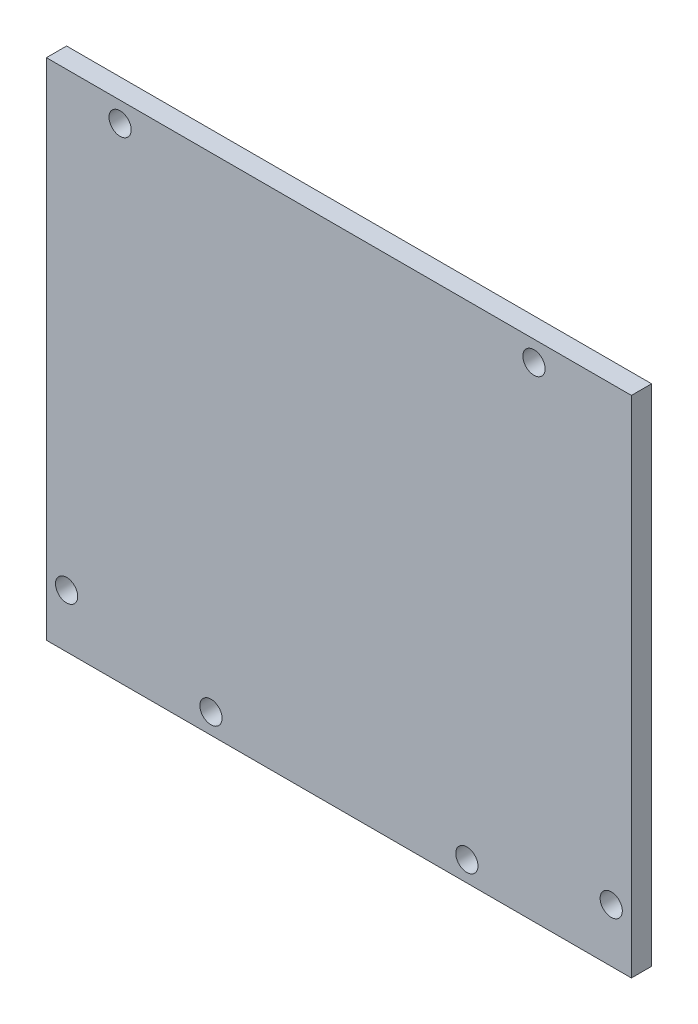
from build123d import *

# Parameters (mm, degrees)
MAIN_STOCK_START           = 11.1
SKETCH_1_W                 = 57.95
SKETCH_1_H                 = 49.98
MAIN_STOCK_DEPTH           = 2
SKETCH_2_R                 = 1.1
COVER_6XD2P2_THROUGH_DEPTH = 71.491027089


with BuildPart() as part:
    # 草图1 → Main_Stock (new body)
    with BuildSketch(Plane.XY.offset(MAIN_STOCK_START)):
        with Locations((24.675, 20.69)):
            Rectangle(SKETCH_1_W, SKETCH_1_H)
    extrude(amount=MAIN_STOCK_DEPTH)

    # 草图2 → Cover_6xD2p2_Through (cut, through all)
    with BuildSketch(Plane.XY.offset(13.1)):
        with Locations((-2.3, 1)):
            Circle(SKETCH_2_R)
        with Locations((51.65, 1)):
            Circle(SKETCH_2_R)
        with Locations((12, -2.3)):
            Circle(SKETCH_2_R)
        with Locations((37.35, -2.3)):
            Circle(SKETCH_2_R)
        with Locations((3, 43.68)):
            Circle(SKETCH_2_R)
        with Locations((44, 43.68)):
            Circle(SKETCH_2_R)
    extrude(amount=-COVER_6XD2P2_THROUGH_DEPTH, mode=Mode.SUBTRACT)


solid = part.part
